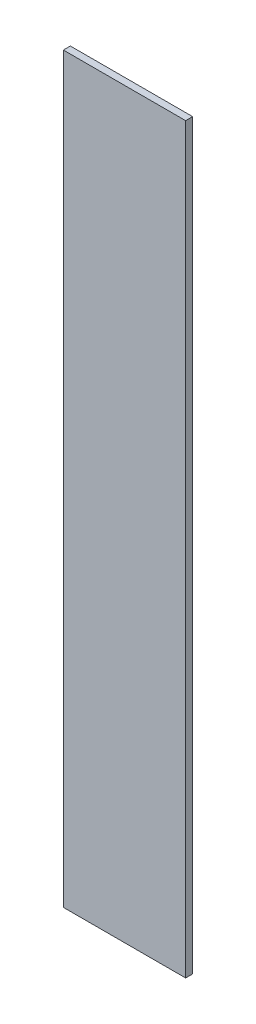
from build123d import *

# Parameters (mm, degrees)
SKETCH1_W           = 28
SKETCH1_H           = 170
BOSS_EXTRUDE1_DEPTH = 1.6


with BuildPart() as part:
    # Sketch1 → Boss-Extrude1 (new body)
    with BuildSketch(Plane.XY):
        with Locations((0, 85)):
            Rectangle(SKETCH1_W, SKETCH1_H)
    extrude(amount=BOSS_EXTRUDE1_DEPTH)


solid = part.part
